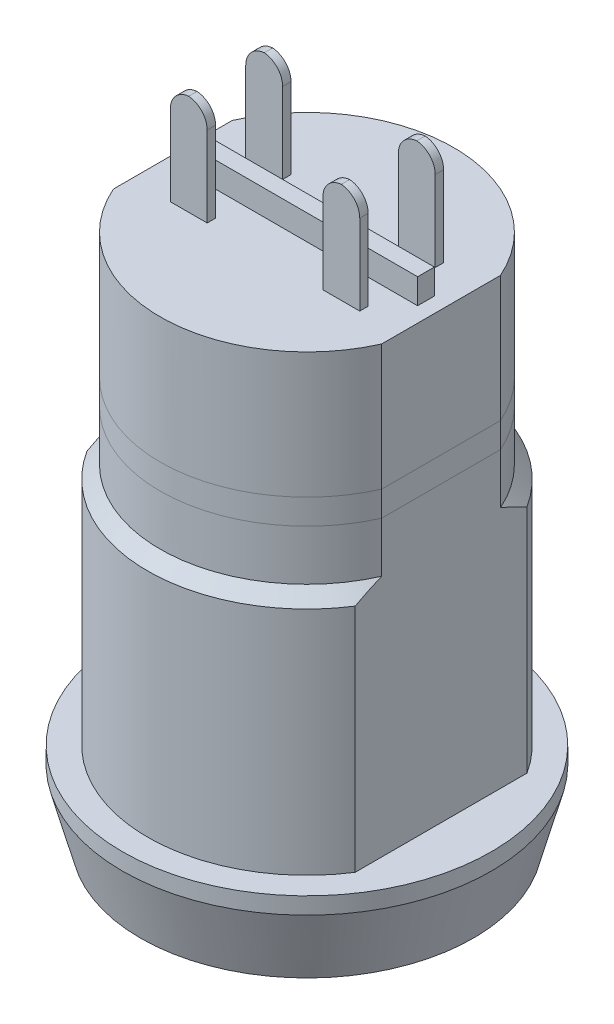
from build123d import *

# Parameters (mm, degrees)
SKETCH_1_R          = 11
EXTRUDE_1_DEPTH     = 5
CHAMFER_1_SIZE      = 4
CHAMFER_1_SIZE2     = 1.07179677
EXTRUDE_3_DEPTH     = 26.5
SKETCH_4_W          = 2
SKETCH_4_H          = 7.5
CUT_EXTRUDE_1_DEPTH = 10
SKETCH_6_W          = 2.2
SKETCH_6_H          = 0.5
EXTRUDE_1_2_DEPTH   = 6
SKETCH_7_W          = 14.2
SKETCH_7_H          = 1
EXTRUDE_2_DEPTH     = 1.5
CUT_EXTRUDE_START   = -12
SKETCH_9_R          = 9.5
SKETCH_9_R_2        = 8.75
CUT_EXTRUDE_2_DEPTH = 12
CHAMFER_2_SIZE      = 0.75
FILLET_1_R          = 1.2


# Some blends are built 0.0001 mm under size
with BuildPart() as part:
    # 草图1 → Extrude 1 (new body)
    with BuildSketch(Plane(origin=(0, 0, 0), x_dir=(1, 0, 0), z_dir=(0, 1, 0))):
        with Locations(Location((0, 0, 0), (0, 0, 270))):
            Circle(SKETCH_1_R)
    extrude(amount=EXTRUDE_1_DEPTH)

    # 倒角1
    chamfer_1_edges = [part.edges().sort_by_distance(p)[0] for p in [
        (0, 0, -11),
    ]]
    chamfer_1_side = [part.faces().sort_by_distance(p)[0] for p in [
        (0, 2.5, -11),
    ]]
    chamfer(chamfer_1_edges, length=CHAMFER_1_SIZE, length2=CHAMFER_1_SIZE2, reference=chamfer_1_side[0])

    # 草图3 → 拉伸3 (add)
    with BuildSketch(Plane(origin=(0, 5, 0), x_dir=(-1, 0, 0), z_dir=(0, 1, 0))):
        with BuildLine():
            Line((-8, 5.123475383), (-8, -5.123475383))
            ThreePointArc((-8, -5.123475383), (0, -9.5), (8, -5.123475383))
            Line((8, -5.123475383), (8, 5.123475383))
            ThreePointArc((8, 5.123475383), (0, 9.5), (-8, 5.123475383))
        make_face()
    extrude(amount=EXTRUDE_3_DEPTH)

    # 草图4 → 切除-拉伸1 (cut)
    with BuildSketch(Plane(origin=(0, 0, 0), x_dir=(-1, 0, 0), z_dir=(0, 1, 0))):
        Rectangle(SKETCH_4_W, SKETCH_4_H)
    extrude(amount=CUT_EXTRUDE_1_DEPTH, mode=Mode.SUBTRACT)

    # 草图6 → Extrude 1 2 (add)
    with BuildSketch(Plane(origin=(0, 31.5, 0), x_dir=(1, 0, 0), z_dir=(0, 1, 0))):
        with Locations((4.55, 2.25)):
            Rectangle(SKETCH_6_W, SKETCH_6_H)
        with Locations((-4.55, 2.25)):
            Rectangle(SKETCH_6_W, SKETCH_6_H)
        with Locations((4.55, -2.25)):
            Rectangle(SKETCH_6_W, SKETCH_6_H)
        with Locations((-4.55, -2.25)):
            Rectangle(SKETCH_6_W, SKETCH_6_H)
    extrude(amount=EXTRUDE_1_2_DEPTH)

    # 草图7 → 凸台-拉伸2 (add)
    with BuildSketch(Plane(origin=(0, 31.5, 0), x_dir=(1, 0, 0), z_dir=(0, 1, 0))):
        Rectangle(SKETCH_7_W, SKETCH_7_H)
    extrude(amount=EXTRUDE_2_DEPTH)

    # 草图9 → 切除-拉伸2 (cut)
    with BuildSketch(Plane(origin=(0, 31.5, 0), x_dir=(1, 0, 0), z_dir=(0, 1, 0)).offset(CUT_EXTRUDE_START)):
        Circle(SKETCH_9_R)
        Circle(SKETCH_9_R_2, mode=Mode.SUBTRACT)
    extrude(amount=CUT_EXTRUDE_2_DEPTH, mode=Mode.SUBTRACT)

    # 倒角2
    chamfer_2_edges = [part.edges().sort_by_distance(p)[0] for p in [
        (0, 19.5, 9.5),
        (0, 19.5, -9.5),
    ]]
    chamfer(chamfer_2_edges, length=CHAMFER_2_SIZE - 0.0001)  # a hair under: the kernel refuses the full size

    # 圆角1
    # the kernel refuses this fillet: 1.2 mm, written as the material it takes off along each edge
    with BuildSketch(Plane(origin=(-3.45, 37.5, -5.5), x_dir=(0, -1, 0), z_dir=(0, 0, 1)), Plane(origin=(-5.65, 37.5, 1), x_dir=(0, -1, 0), z_dir=(0, 0, -1)), Plane(origin=(5.65, 37.5, -1), x_dir=(0, -1, 0), z_dir=(0, 0, 1)), Plane(origin=(3.45, 37.5, 5.5), x_dir=(0, -1, 0), z_dir=(0, 0, -1))) as fillet_1_piece_1:
        with BuildLine():
            CenterArc((FILLET_1_R, -FILLET_1_R), FILLET_1_R, 90, 90)
            Line((0, -FILLET_1_R), (0, 0))
            Line((0, 0), (FILLET_1_R, 0))
        make_face()
    extrude(amount=6.5, mode=Mode.SUBTRACT)
    with BuildSketch(Plane(origin=(3.45, 37.5, -5.5), x_dir=(0, -1, 0), z_dir=(0, 0, 1)), Plane(origin=(5.65, 37.5, 1), x_dir=(0, -1, 0), z_dir=(0, 0, -1)), Plane(origin=(-5.65, 37.5, -1), x_dir=(0, -1, 0), z_dir=(0, 0, 1)), Plane(origin=(-3.45, 37.5, 5.5), x_dir=(0, -1, 0), z_dir=(0, 0, -1))) as fillet_1_piece_2:
        with BuildLine():
            CenterArc((FILLET_1_R, FILLET_1_R), FILLET_1_R, 180, 90)
            Line((0, FILLET_1_R), (0, 0))
            Line((0, 0), (FILLET_1_R, 0))
        make_face()
    extrude(amount=6.5, mode=Mode.SUBTRACT)


solid = part.part
